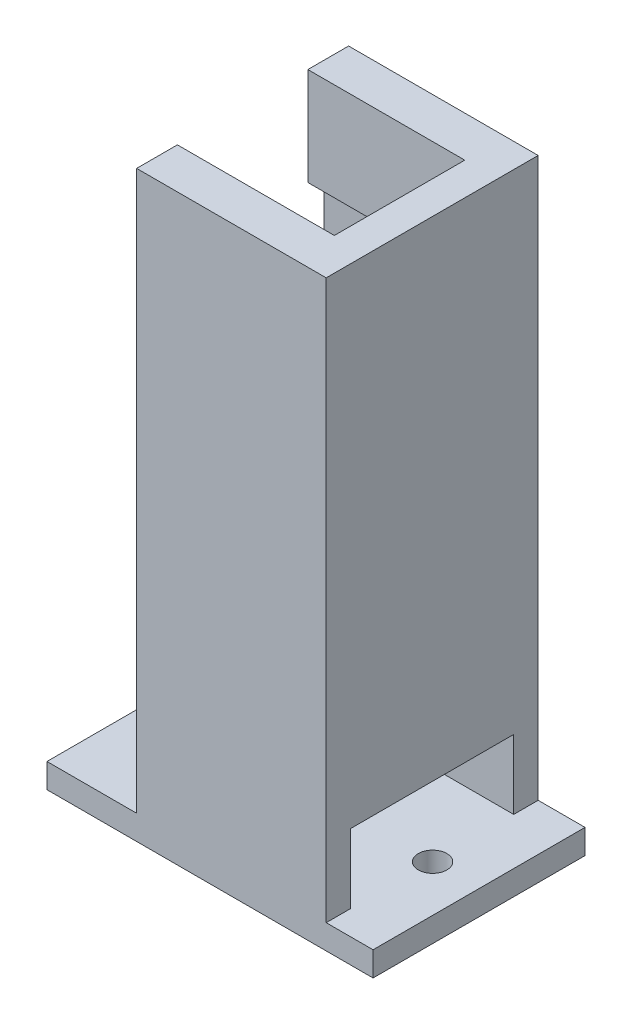
from build123d import *

# Parameters (mm, degrees)
SKETCH1_W           = 40
SKETCH1_H           = 26
BOSS_EXTRUDE1_DEPTH = 3
SKETCH2_R           = 1.75
CUT_EXTRUDE1_DEPTH  = 3
SKETCH3_W           = 19.25
SKETCH3_H           = 3
BOSS_EXTRUDE2_DEPTH = 56.5
SKETCH5_W           = 19.25
SKETCH5_H           = 5
BOSS_EXTRUDE4_DEPTH = 12
SKETCH6_R           = 2.5
CUT_EXTRUDE2_DEPTH  = 15
SKETCH7_W           = 26
SKETCH7_H           = 68.5
BOSS_EXTRUDE5_DEPTH = 4
SKETCH9_W           = 20
SKETCH9_H           = 8.5
CUT_EXTRUDE3_DEPTH  = 4


with BuildPart() as part:
    # Sketch1 → Boss-Extrude1 (new body)
    with BuildSketch(Plane(origin=(0, 0, 0), x_dir=(1, 0, 0), z_dir=(0, 1, 0))):
        Rectangle(SKETCH1_W, SKETCH1_H)
    extrude(amount=BOSS_EXTRUDE1_DEPTH)

    # Sketch2 → Cut-Extrude1 (cut)
    with BuildSketch(Plane(origin=(0, 3, 0), x_dir=(1, 0, 0), z_dir=(0, 1, 0))):
        with Locations((14.3, 0)):
            Circle(SKETCH2_R)
        with Locations((-14.3, 0)):
            Circle(SKETCH2_R)
    extrude(amount=-CUT_EXTRUDE1_DEPTH, mode=Mode.SUBTRACT)

    # Sketch3 → Boss-Extrude2 (add)
    with BuildSketch(Plane(origin=(0, 3, 0), x_dir=(1, 0, 0), z_dir=(0, 1, 0))):
        with Locations((0.625, -11.5)):
            Rectangle(SKETCH3_W, SKETCH3_H)
        with Locations((0.625, 11.5)):
            Rectangle(SKETCH3_W, SKETCH3_H)
    extrude(amount=BOSS_EXTRUDE2_DEPTH)

    # Sketch5 → Boss-Extrude4 (add)
    with BuildSketch(Plane(origin=(0, 59.5, 0), x_dir=(1, 0, 0), z_dir=(0, 1, 0))):
        with Locations((0.625, 10.5)):
            Rectangle(SKETCH5_W, SKETCH5_H)
        with Locations((0.625, -10.5)):
            Rectangle(SKETCH5_W, SKETCH5_H)
    extrude(amount=BOSS_EXTRUDE4_DEPTH)

    # Sketch6 → Cut-Extrude2 (cut)
    with BuildSketch(Plane(origin=(0, 3, 0), x_dir=(1, 0, 0), z_dir=(0, 1, 0))):
        Circle(SKETCH6_R)
    extrude(amount=-CUT_EXTRUDE2_DEPTH, mode=Mode.SUBTRACT)

    # Sketch7 → Boss-Extrude5 (add)
    with BuildSketch(Plane(origin=(10.25, 0, 0), x_dir=(0, 0, -1), z_dir=(1, 0, 0))):
        with Locations((0, 37.25)):
            Rectangle(SKETCH7_W, SKETCH7_H)
    extrude(amount=BOSS_EXTRUDE5_DEPTH)

    # Sketch9 → Cut-Extrude3 (cut)
    with BuildSketch(Plane(origin=(14.25, 0, 0), x_dir=(0, 0, -1), z_dir=(1, 0, 0))):
        with Locations((0, 7.25)):
            Rectangle(SKETCH9_W, SKETCH9_H)
    extrude(amount=-CUT_EXTRUDE3_DEPTH, mode=Mode.SUBTRACT)


solid = part.part
